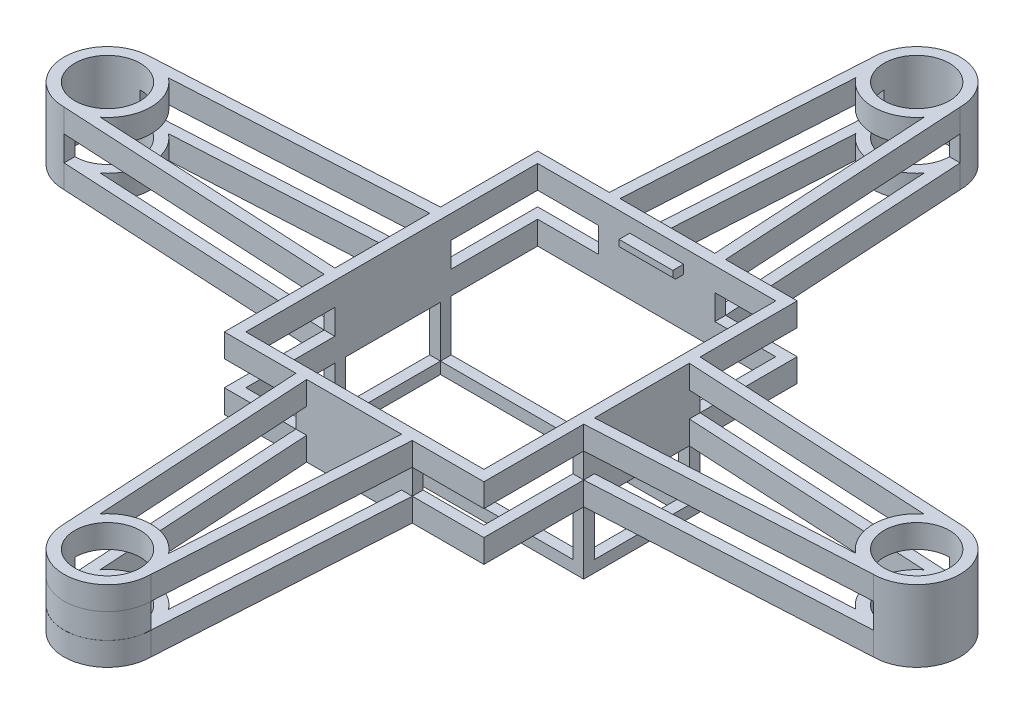
from build123d import *

# Parameters (mm, degrees)
SKETCH1_R               = 3.65
SKETCH1_W               = 26.6
SKETCH1_H               = 32.6
BOSS_EXTRUDE1_DEPTH     = 8
SKETCH2_W               = 3
SKETCH2_H               = 0.7
BOSS_EXTRUDE2_DEPTH     = 1.2
SKETCH3_W               = 3
SKETCH3_H               = 0.7
BOSS_EXTRUDE3_DEPTH     = 1.2
CHAMFER1_SIZE           = 1.2
CUT_EXTRUDE1_DEPTH      = 85.649459397
CUT_EXTRUDE1_DEPTH_BACK = 85.649459397
SKETCH4_W               = 48.801078557
SKETCH4_H               = 1.4
SKETCH4_W_2             = 10.59579159
SKETCH4_W_3             = 46.838011079
BOSS_EXTRUDE4_START     = -5.4
SKETCH5_W               = 13
SKETCH5_H               = 1.2
SKETCH5_W_2             = 1.2
SKETCH5_H_2             = 13
BOSS_EXTRUDE4_DEPTH     = 2.8
BOSS_EXTRUDE5_REACH     = 77.99
SKETCH7_W               = 1.2
SKETCH7_H               = 1.202104206
SKETCH7_H_2             = 1.201731925
BOSS_EXTRUDE6_DEPTH     = 7
SKETCH8_W               = 1.202104206
SKETCH8_H               = 1.3
SKETCH8_W_2             = 1.201731925
BOSS_EXTRUDE7_DEPTH     = 26.6
SKETCH9_W               = 1.2
SKETCH9_H               = 1.3
BOSS_EXTRUDE8_DEPTH     = 11.797895795


with BuildPart() as part:
    # Sketch1 → Boss-Extrude1 (new body)
    with BuildSketch(Plane(origin=(0, 0, 0), x_dir=(1, 0, 0), z_dir=(0, 1, 0))):
        with BuildLine():
            Line((-7.021942446, 23.451798561), (-15.021942446, 23.451798561))
            Line((-15.021942446, 23.451798561), (-15.021942446, 12.601798561))
            Line((-15.021942446, 12.601798561), (-45.721942446, 10.951798561))
            ThreePointArc((-45.721942446, 10.951798561), (-50.571942446, 6.101798561), (-45.721942446, 1.251798561))
            Line((-45.721942446, 1.251798561), (-15.021942446, -0.398201439))
            Line((-15.021942446, -0.398201439), (-15.021942446, -11.548201439))
            Line((-15.021942446, -11.548201439), (-7.021942446, -11.548201439))
            Line((-7.021942446, -11.548201439), (-5.371942446, -39.398201439))
            ThreePointArc((-5.371942446, -39.398201439), (-0.37187086, -43.955153005), (4.337327046, -39.098201439))
            Line((4.337327046, -39.098201439), (5.978057554, -11.548201439))
            Line((5.978057554, -11.548201439), (13.978057554, -11.548201439))
            Line((13.978057554, -11.548201439), (13.978057554, -0.398201439))
            Line((13.978057554, -0.398201439), (44.678057554, 1.251798561))
            ThreePointArc((44.678057554, 1.251798561), (49.528057554, 6.101798561), (44.678057554, 10.951798561))
            Line((44.678057554, 10.951798561), (13.978057554, 12.601798561))
            Line((13.978057554, 12.601798561), (13.978057554, 23.451798561))
            Line((13.978057554, 23.451798561), (5.978057554, 23.451798561))
            Line((5.978057554, 23.451798561), (4.328057554, 51.301798561))
            ThreePointArc((4.328057554, 51.301798561), (-0.521942446, 56.151798561), (-5.371942446, 51.301798561))
            Line((-5.371942446, 51.301798561), (-7.021942446, 23.451798561))
        make_face()
        with Locations(Location((-0.521942446, -39.098201439, 0), (0, 0, 270))):
            Circle(SKETCH1_R, mode=Mode.SUBTRACT)
        with BuildLine():
            Line((4.775953349, -11.548201439), (3.309960917, -36.110055423))
            ThreePointArc((3.309960917, -36.110055423), (-0.521942446, -34.238931946), (-4.35384581, -36.110055423))
            Line((-4.35384581, -36.110055423), (-5.819838241, -11.548201439))
            Line((-5.819838241, -11.548201439), (4.775953349, -11.548201439))
        make_face(mode=Mode.SUBTRACT)
        with Locations((-0.521942446, 5.951798561)):
            Rectangle(SKETCH1_W, SKETCH1_H, mode=Mode.SUBTRACT)
        with Locations(Location((-45.721942446, 6.101798561, 0), (0, 0, 270))):
            Circle(SKETCH1_R, mode=Mode.SUBTRACT)
        with BuildLine():
            Line((-42.720356894, 9.911389638), (-15.021942446, 11.400066636))
            Line((-15.021942446, 11.400066636), (-15.021942446, 0.803530486))
            Line((-15.021942446, 0.803530486), (-42.720356894, 2.292207484))
            ThreePointArc((-42.720356894, 2.292207484), (-40.871942446, 6.101798561), (-42.720356894, 9.911389638))
        make_face(mode=Mode.SUBTRACT)
        with BuildLine():
            Line((-5.819838241, 23.451798561), (-4.34653611, 48.319352702))
            ThreePointArc((-4.34653611, 48.319352702), (-0.521942446, 46.451798561), (3.302651218, 48.319352702))
            Line((3.302651218, 48.319352702), (4.775953349, 23.451798561))
            Line((4.775953349, 23.451798561), (-5.819838241, 23.451798561))
        make_face(mode=Mode.SUBTRACT)
        with Locations(Location((-0.521942446, 51.301798561, 0), (0, 0, 270))):
            Circle(SKETCH1_R, mode=Mode.SUBTRACT)
        with BuildLine():
            Line((41.676472002, 2.292207484), (13.978057554, 0.803530486))
            Line((13.978057554, 0.803530486), (13.978057554, 11.400066636))
            Line((13.978057554, 11.400066636), (41.676472002, 9.911389638))
            ThreePointArc((41.676472002, 9.911389638), (39.828057554, 6.101798561), (41.676472002, 2.292207484))
        make_face(mode=Mode.SUBTRACT)
        with Locations(Location((44.678057554, 6.101798561, 0), (0, 0, 270))):
            Circle(SKETCH1_R, mode=Mode.SUBTRACT)
    extrude(amount=BOSS_EXTRUDE1_DEPTH)

    # Sketch2 → Boss-Extrude2 (add)
    with BuildSketch(Plane.XY.offset(-22.251798561)):
        with Locations((-2.021942446, 6.05)):
            Rectangle(SKETCH2_W, SKETCH2_H)
        with Locations((0.978057554, 6.05)):
            Rectangle(SKETCH2_W, SKETCH2_H)
    extrude(amount=BOSS_EXTRUDE2_DEPTH)

    # Sketch3 → Boss-Extrude3 (add)
    with BuildSketch(Plane(origin=(0, 0, 10.348201439), x_dir=(-1, 0, 0), z_dir=(0, 0, -1))):
        with Locations((-0.978057554, 6.05)):
            Rectangle(SKETCH3_W, SKETCH3_H)
        with Locations((2.021942446, 6.05)):
            Rectangle(SKETCH3_W, SKETCH3_H)
    extrude(amount=BOSS_EXTRUDE3_DEPTH)

    # Chamfer1
    chamfer1_edges = [part.edges().sort_by_distance(p)[0] for p in [
        (-0.521942446, 5.7, -22.251798561),
        (-0.521942446, 5.7, 10.348201439),
    ]]
    chamfer(chamfer1_edges, length=CHAMFER1_SIZE - 0.0001)  # a hair under: the kernel refuses the full size

    # Sketch4 → Cut-Extrude1 (cut, two sides: drawn at the far end of the back side and taken through both)
    with BuildSketch(Plane(origin=(0, 0, -23.451798561), x_dir=(-1, 0, 0), z_dir=(0, 0, -1)).offset(-CUT_EXTRUDE1_DEPTH_BACK)):
        with Locations((-29.176492628, 3.3)):
            Rectangle(SKETCH4_W, SKETCH4_H)
        with Locations((-29.176492628, 4.7)):
            Rectangle(SKETCH4_W, SKETCH4_H)
        with Locations((0.521942446, 4.7)):
            Rectangle(SKETCH4_W_2, SKETCH4_H)
        with Locations((0.521942446, 3.3)):
            Rectangle(SKETCH4_W_2, SKETCH4_H)
        with Locations((29.238843781, 3.3)):
            Rectangle(SKETCH4_W_3, SKETCH4_H)
        with Locations((29.238843781, 4.7)):
            Rectangle(SKETCH4_W_3, SKETCH4_H)
    extrude(amount=CUT_EXTRUDE1_DEPTH + CUT_EXTRUDE1_DEPTH_BACK, mode=Mode.SUBTRACT)


with BuildPart() as cut_extrude1_piece_1:
    # of the separate pieces the step leaves, piece 1, a body of its own (cut_extrude1_pieces)
    add(part.part.solids().sort_by_distance((-3.521942446, 6.4, 10.348201439))[0])



with BuildPart() as cut_extrude1_piece_2:
    # of the separate pieces the step leaves, piece 2, a body of its own (cut_extrude1_pieces)
    add(part.part.solids().sort_by_distance((12.778057554, 2.6, 10.348201439))[0])


with BuildPart() as cut_extrude1_piece_1_1:
    add(cut_extrude1_piece_1.part)

    add(cut_extrude1_piece_2.part)  # Boss-Extrude4 merges Cut-Extrude1 piece 2
    # Sketch5 → Boss-Extrude4 (add)
    with BuildSketch(Plane(origin=(0, 8, 0), x_dir=(1, 0, 0), z_dir=(0, 1, 0)).offset(BOSS_EXTRUDE4_START)):
        with Locations((-0.521942446, 22.851798561)):
            Rectangle(SKETCH5_W, SKETCH5_H)
        with Locations((-0.521942446, -10.948201439)):
            Rectangle(SKETCH5_W, SKETCH5_H)
        with Locations((-14.421942446, 6.101798561)):
            Rectangle(SKETCH5_W_2, SKETCH5_H_2)
        with Locations((13.378057554, 6.101798561)):
            Rectangle(SKETCH5_W_2, SKETCH5_H_2)
    extrude(amount=BOSS_EXTRUDE4_DEPTH)

    # Sketch6 → Boss-Extrude5 (add, up to next)
    with BuildSketch(Plane(origin=(0, 8, 0), x_dir=(1, 0, 0), z_dir=(0, 1, 0)), mode=Mode.PRIVATE) as boss_extrude5_sk1:
        with BuildLine():
            Line((-5.371942446, 51.301798561), (-4.171942446, 51.301798561))
            ThreePointArc((-4.171942446, 51.301798561), (-0.521942446, 54.951798561), (3.128057554, 51.301798561))
            Line((3.128057554, 51.301798561), (4.328057554, 51.301798561))
            ThreePointArc((4.328057554, 51.301798561), (-0.521942446, 56.151798561), (-5.371942446, 51.301798561))
        make_face()
    boss_extrude5_tool1 = extrude(boss_extrude5_sk1.sketch, amount=-BOSS_EXTRUDE5_REACH, mode=Mode.PRIVATE) - cut_extrude1_piece_1_1.part
    # Sketch6 → Boss-Extrude5 (add, up to next)
    with BuildSketch(Plane(origin=(0, 8, 0), x_dir=(1, 0, 0), z_dir=(0, 1, 0)), mode=Mode.PRIVATE) as boss_extrude5_sk2:
        with BuildLine():
            Line((3.128057554, -39.098201439), (4.328057554, -39.098201439))
            ThreePointArc((4.328057554, -39.098201439), (-0.521942446, -43.948201439), (-5.371942446, -39.098201439))
            Line((-5.371942446, -39.098201439), (-4.171942446, -39.098201439))
            ThreePointArc((-4.171942446, -39.098201439), (-0.521942446, -42.748201439), (3.128057554, -39.098201439))
        make_face()
    boss_extrude5_tool2 = extrude(boss_extrude5_sk2.sketch, amount=-BOSS_EXTRUDE5_REACH, mode=Mode.PRIVATE) - cut_extrude1_piece_1_1.part
    # Sketch6 → Boss-Extrude5 (add, up to next)
    with BuildSketch(Plane(origin=(0, 8, 0), x_dir=(1, 0, 0), z_dir=(0, 1, 0)), mode=Mode.PRIVATE) as boss_extrude5_sk3:
        with BuildLine():
            Line((44.678057554, 9.751798561), (44.678057554, 10.951798561))
            ThreePointArc((44.678057554, 10.951798561), (49.528057554, 6.101798561), (44.678057554, 1.251798561))
            Line((44.678057554, 1.251798561), (44.678057554, 2.451798561))
            ThreePointArc((44.678057554, 2.451798561), (48.328057554, 6.101798561), (44.678057554, 9.751798561))
        make_face()
    boss_extrude5_tool3 = extrude(boss_extrude5_sk3.sketch, amount=-BOSS_EXTRUDE5_REACH, mode=Mode.PRIVATE) - cut_extrude1_piece_1_1.part
    # Sketch6 → Boss-Extrude5 (add, up to next)
    with BuildSketch(Plane(origin=(0, 8, 0), x_dir=(1, 0, 0), z_dir=(0, 1, 0)), mode=Mode.PRIVATE) as boss_extrude5_sk4:
        with BuildLine():
            Line((-45.721942446, 1.251798561), (-45.721942446, 2.451798561))
            ThreePointArc((-45.721942446, 2.451798561), (-49.371942446, 6.101798561), (-45.721942446, 9.751798561))
            Line((-45.721942446, 9.751798561), (-45.721942446, 10.951798561))
            ThreePointArc((-45.721942446, 10.951798561), (-50.571942446, 6.101798561), (-45.721942446, 1.251798561))
        make_face()
    boss_extrude5_tool4 = extrude(boss_extrude5_sk4.sketch, amount=-BOSS_EXTRUDE5_REACH, mode=Mode.PRIVATE) - cut_extrude1_piece_1_1.part
    add(boss_extrude5_tool1.solids().sort_by_distance((-4.771942, 8, -51.410248))[0])
    add(boss_extrude5_tool2.solids().sort_by_distance((-0.521942, 8, 43.839752))[0])
    add(boss_extrude5_tool3.solids().sort_by_distance((44.786507, 8, -10.351799))[0])
    add(boss_extrude5_tool4.solids().sort_by_distance((-45.830392, 8, -10.351799))[0])

    # Sketch7 → Boss-Extrude6 (add)
    with BuildSketch(Plane.XZ):
        with Locations((-14.421942446, -0.202850664)):
            Rectangle(SKETCH7_W, SKETCH7_H)
        with Locations((-14.421942446, -12.000932599)):
            Rectangle(SKETCH7_W, SKETCH7_H_2)
        with Locations((13.378057554, -0.202850664)):
            Rectangle(SKETCH7_W, SKETCH7_H)
        with Locations((13.378057554, -12.000932599)):
            Rectangle(SKETCH7_W, SKETCH7_H_2)
    extrude(amount=BOSS_EXTRUDE6_DEPTH)

    # Sketch8 → Boss-Extrude7 (add)
    with BuildSketch(Plane(origin=(-13.821942446, 0, 0), x_dir=(0, 0, -1), z_dir=(1, 0, 0))):
        with Locations((0.202850664, -6.35)):
            Rectangle(SKETCH8_W, SKETCH8_H)
        with Locations((12.000932599, -6.35)):
            Rectangle(SKETCH8_W_2, SKETCH8_H)
    extrude(amount=BOSS_EXTRUDE7_DEPTH)

    # Sketch9 → Boss-Extrude8 (add)
    with BuildSketch(Plane(origin=(0, 0, -12.601798561), x_dir=(-1, 0, 0), z_dir=(0, 0, -1))):
        with Locations((-13.378057554, -6.35)):
            Rectangle(SKETCH9_W, SKETCH9_H)
        with Locations((14.421942446, -6.35)):
            Rectangle(SKETCH9_W, SKETCH9_H)
    extrude(amount=-BOSS_EXTRUDE8_DEPTH)


solid = cut_extrude1_piece_1_1.part
